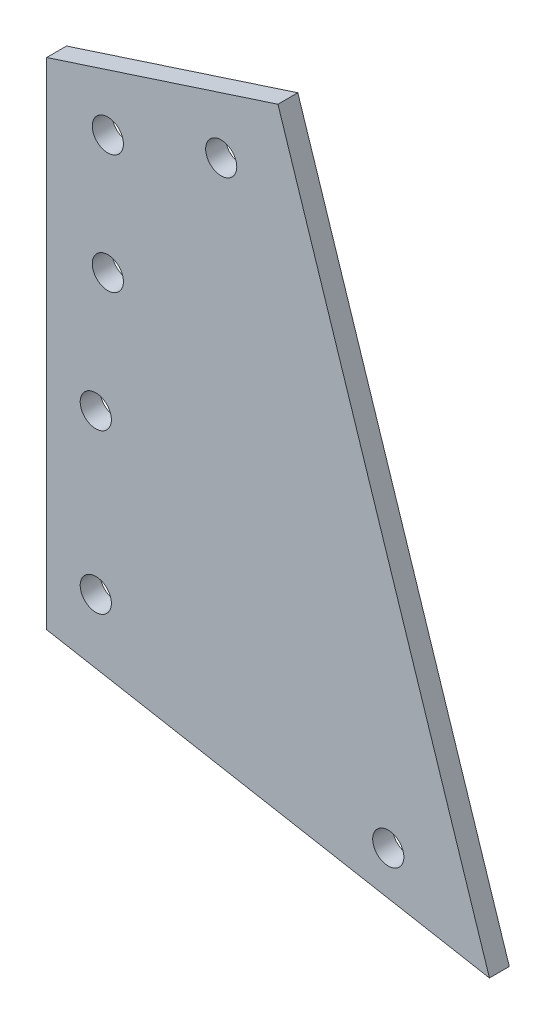
from build123d import *

# Parameters (mm, degrees)
BOSS_EXTRUDE1_DEPTH    = 3.175
F_10_CLEARANCE_HOLE1_D = 4.9784


with BuildPart() as part:
    # Sketch2 → Boss-Extrude1 (new body)
    with BuildSketch(Plane.XY):
        Polygon((75.602414801, 191.083301642), (41.805670474, 295.098985267), (4.854209552, 283.092727808), (4.854209552, 203.901454104), align=None)
    extrude(amount=BOSS_EXTRUDE1_DEPTH)

    # #10 Clearance Hole1 (through all)
    with Locations(Plane.XY.offset(3.175)):
        with Locations((32.740251946, 283.138719963), (59.435154755, 200.980257064), (12.7, 238.125), (12.7, 212.725), (14.622625311, 277.25194622), (14.622625311, 258.20194622)):
            Hole(F_10_CLEARANCE_HOLE1_D / 2)


solid = part.part
